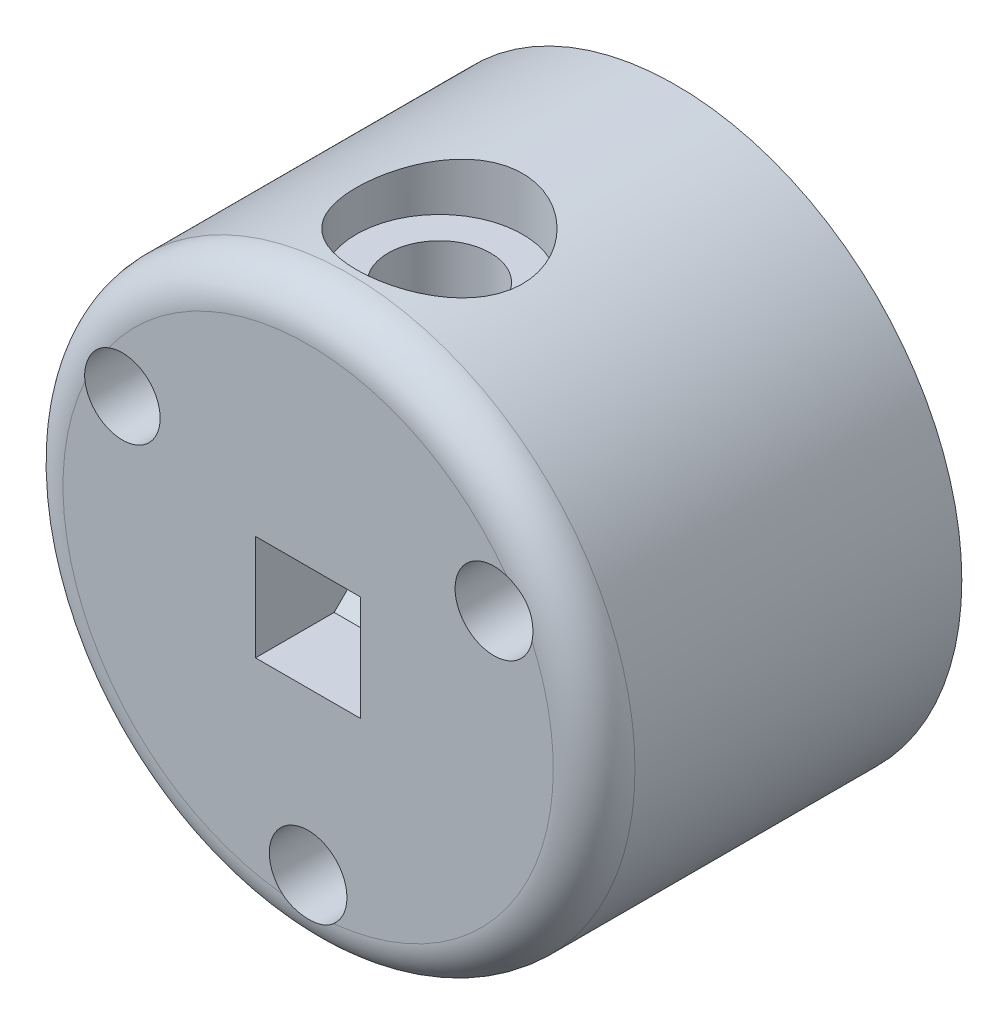
from build123d import *

# Parameters (mm, degrees)
SKETCH_1_R           = 14
EXTRUDE_1_DEPTH      = 22
SKETCH_3_R           = 7.35
CUT_EXTRUDE_1_DEPTH  = 6
SKETCH_2_R           = 1.1
CUT_EXTRUDE_2_DEPTH  = 32
SKETCH_4_R           = 1.9
SKETCH_4_R_2         = 1.85
CUT_EXTRUDE_3_DEPTH  = 19
SKETCH_5_W           = 5.15
SKETCH_5_H           = 5.15
CUT_EXTRUDE_4_DEPTH  = 13
EXTRUDE_2_REACH      = 32.899
SKETCH_12_R          = 19.208398283
CUT_EXTRUDE_9_DEPTH  = 4
FILLET_1_R           = 2
SKETCH_14_R          = 2.5
CUT_EXTRUDE_10_DEPTH = 18
SKETCH_15_R          = 4.075
CUT_EXTRUDE_11_DEPTH = 2


with BuildPart() as part:
    # 草图1 → 凸台-拉伸1 (new body)
    with BuildSketch(Plane.XY):
        Circle(SKETCH_1_R)
    extrude(amount=EXTRUDE_1_DEPTH)

    # 草图3 → 切除-拉伸1 (cut)
    with BuildSketch(Plane(origin=(0, 0, 0), x_dir=(-1, 0, 0), z_dir=(0, 0, -1))):
        Circle(SKETCH_3_R)
    extrude(amount=-CUT_EXTRUDE_1_DEPTH, mode=Mode.SUBTRACT)

    # 草图2 → 切除-拉伸2 (cut)
    with BuildSketch(Plane.XY.offset(22)):
        with Locations((-9.09326674, 5.25)):
            Circle(SKETCH_2_R)
        with Locations((9.09326674, 5.25)):
            Circle(SKETCH_2_R)
        with Locations((0, -10.5)):
            Circle(SKETCH_2_R)
    extrude(amount=-CUT_EXTRUDE_2_DEPTH, mode=Mode.SUBTRACT)

    # 草图4 → 切除-拉伸3 (cut)
    with BuildSketch(Plane.XY.offset(22)):
        with Locations((9.09326674, 5.25)):
            Circle(SKETCH_4_R)
        with Locations((0, -10.5)):
            Circle(SKETCH_4_R)
        with Locations((-9.09326674, 5.25)):
            Circle(SKETCH_4_R_2)
    extrude(amount=-CUT_EXTRUDE_3_DEPTH, mode=Mode.SUBTRACT)

    # 草图5 → 切除-拉伸4 (cut)
    with BuildSketch(Plane.XY.offset(22)):
        Rectangle(SKETCH_5_W, SKETCH_5_H)
    extrude(amount=-CUT_EXTRUDE_4_DEPTH, mode=Mode.SUBTRACT)

    # 草图6 → 凸台-拉伸2 (add, up to next)
    with BuildSketch(Plane(origin=(-2.575, 0, 0), x_dir=(0, 0, -1), z_dir=(1, 0, 0)), mode=Mode.PRIVATE) as extrude_2_sk1:
        Polygon((-9, -2.575), (-14.15, -2.575), (-9, 2.575), align=None)
    extrude_2_tool1 = extrude(extrude_2_sk1.sketch, amount=EXTRUDE_2_REACH, mode=Mode.PRIVATE) - part.part
    add(extrude_2_tool1.solids().sort_by_distance((-2.575, -0.858333, 10.716667))[0])

    # 草图12 → 切除-拉伸9 (cut)
    with BuildSketch(Plane.XY.offset(22)):
        Circle(SKETCH_12_R)
    extrude(amount=-CUT_EXTRUDE_9_DEPTH, mode=Mode.SUBTRACT)

    # 圆角1
    # the kernel refuses this fillet: 2 mm, written as the material it takes off along each edge
    with BuildSketch(Plane(origin=(0, 0, 18), x_dir=(1, 0, 0), z_dir=(0, 1, 0))) as fillet_1_piece_1:
        with BuildLine():
            CenterArc((14 - FILLET_1_R, FILLET_1_R), FILLET_1_R, 270, 90)
            Line((14, FILLET_1_R), (14, 0))
            Line((14, 0), (14 - FILLET_1_R, 0))
        make_face()
    revolve(axis=Axis((0, 0, 18), (0, 0, -1)), mode=Mode.SUBTRACT)

    # 草图14 → 切除-拉伸10 (cut)
    with BuildSketch(Plane(origin=(0, 2.575, 0), x_dir=(-1, 0, 0), z_dir=(0, -1, 0))):
        with Locations(Location((0, -11.575, 0), (0, 0, 90))):
            Circle(SKETCH_14_R)
    extrude(amount=-CUT_EXTRUDE_10_DEPTH, mode=Mode.SUBTRACT)

    # 草图15 → 切除-拉伸11 (cut, symmetric)
    with BuildSketch(Plane(origin=(0, 13.416407865, 0), x_dir=(1, 0, 0), z_dir=(0, 1, 0))):
        with Locations(Location((0, -11.575, 0), (0, 0, 270))):
            Circle(SKETCH_15_R)
    extrude(amount=CUT_EXTRUDE_11_DEPTH, both=True, mode=Mode.SUBTRACT)


solid = part.part
